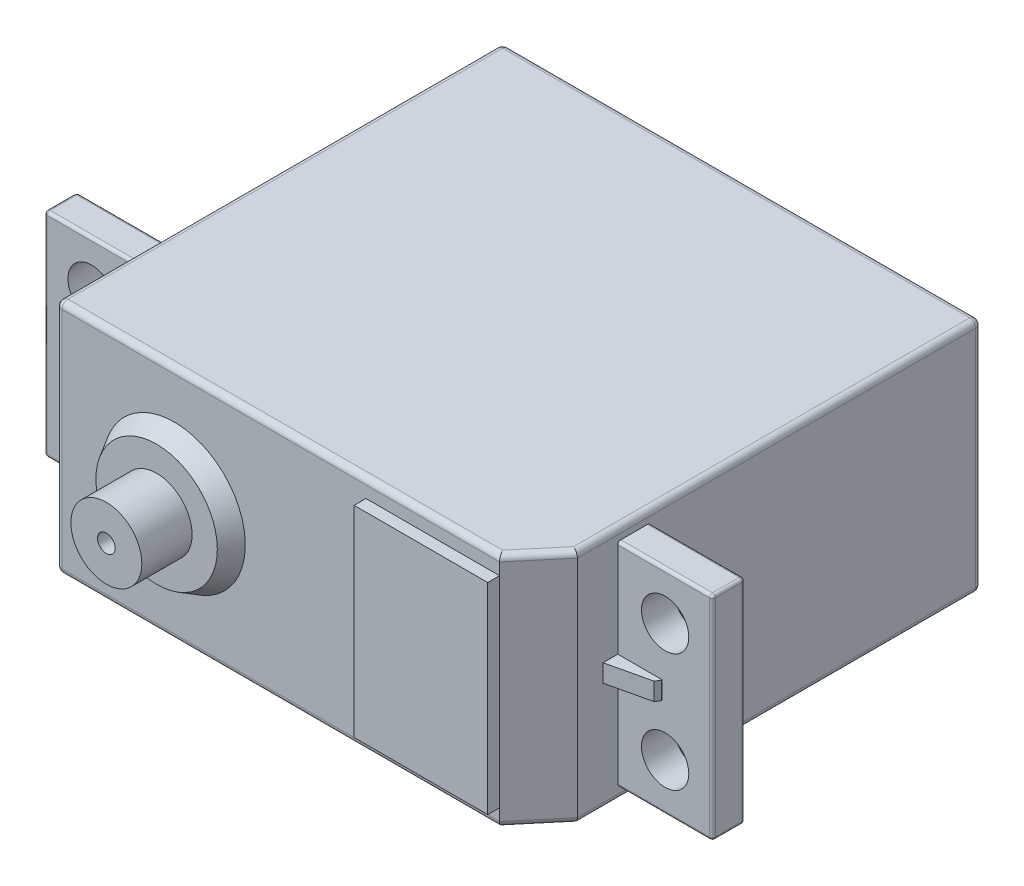
from build123d import *
from OCP.BRepFilletAPI import BRepFilletAPI_MakeChamfer

# Parameters (mm, degrees)
SKETCH1_W                 = 40.5
SKETCH1_H                 = 20
BOSS_EXTRUDE1_DEPTH       = 37.75
SKETCH2_W                 = 2.75
SKETCH2_H                 = 18
BOSS_EXTRUDE2_DEPTH       = 8
SKETCH3_R                 = 2
CUT_EXTRUDE1_DEPTH        = 4
SKETCH4_W                 = 3.75
SKETCH4_H                 = 1.5
BOSS_EXTRUDE3_DEPTH       = 1.25
CHAMFER1_SIZE2            = 0.865755717
CHAMFER1_SIZE             = 3.75
CHAMFER2_SIZE             = 0.25
CHAMFER2_SIZE2            = 0.333581356
FILLET1_R                 = 0.25
CHAMFER1_OF_MIRROR1_SIZE2 = 0.865755717
CHAMFER1_OF_MIRROR1_SIZE  = 3.75
CHAMFER2_OF_MIRROR1_SIZE2 = 0.25
CHAMFER2_OF_MIRROR1_SIZE  = 0.333581356
FILLET1_OF_MIRROR1_R      = 0.25
SKETCH5_W                 = 11.3
SKETCH5_H                 = 17
BOSS_EXTRUDE4_DEPTH       = 1
SKETCH6_R                 = 6
BOSS_EXTRUDE5_DEPTH       = 1.5
CHAMFER3_SIZE2            = 0.866025404
CHAMFER3_SIZE             = 1.5
SKETCH7_R                 = 3
SKETCH7_R_2               = 0.75
BOSS_EXTRUDE6_DEPTH       = 4.25
SKETCH8_W                 = 3.25
SKETCH8_H                 = 7.25
SKETCH8_W_2               = 1.25
SKETCH8_H_2               = 5.25
BOSS_EXTRUDE7_DEPTH       = 2.5
CHAMFER5_SIZE2            = 3.575260778
CHAMFER5_SIZE             = 3
CHAMFER4_SIZE             = 2.5
CHAMFER4_SIZE_2           = 0.669872981
FILLET2_R                 = 0.5


with BuildPart() as part:
    # Sketch1 → Boss-Extrude1 (new body)
    with BuildSketch(Plane.XY):
        Rectangle(SKETCH1_W, SKETCH1_H)
    extrude(amount=BOSS_EXTRUDE1_DEPTH)

    # Sketch2 → Boss-Extrude2 (add)
    with BuildSketch(Plane(origin=(20.25, 0, 0), x_dir=(0, 0, -1), z_dir=(1, 0, 0))):
        with Locations((-29.375, 0)):
            Rectangle(SKETCH2_W, SKETCH2_H)
    boss_extrude2 = extrude(amount=BOSS_EXTRUDE2_DEPTH)

    # Sketch3 → Cut-Extrude1 (cut)
    with BuildSketch(Plane.XY.offset(30.75)):
        with Locations((24.25, 5)):
            Circle(SKETCH3_R)
        with Locations((24.25, -5)):
            Circle(SKETCH3_R)
    cut_extrude1 = extrude(amount=-CUT_EXTRUDE1_DEPTH, mode=Mode.SUBTRACT)

    # Sketch4 → Boss-Extrude3 (add)
    with BuildSketch(Plane.XY.offset(30.75)):
        with Locations((22.125, 0)):
            Rectangle(SKETCH4_W, SKETCH4_H)
    boss_extrude3 = extrude(amount=BOSS_EXTRUDE3_DEPTH)

    # Chamfer1
    chamfer1_edges = [part.edges().sort_by_distance(p)[0] for p in [
        (24, 0, 32),
    ]]
    chamfer1_side = [part.faces().sort_by_distance(p)[0] for p in [
        (23.982684886, 0, 32),
    ]]
    chamfer(chamfer1_edges, length=CHAMFER1_SIZE - 0.0001, length2=CHAMFER1_SIZE2 - 0.0001, reference=chamfer1_side[0])  # a hair under: the kernel refuses the full size

    # Chamfer2
    chamfer2_edges = [part.edges().sort_by_distance(p)[0] for p in [
        (24, 0, 31.134344283),
    ]]
    chamfer2_side = [part.faces().sort_by_distance(p)[0] for p in [
        (22.12505, 0, 31.567172141),
    ]]
    chamfer(chamfer2_edges, length=CHAMFER2_SIZE, length2=CHAMFER2_SIZE2, reference=chamfer2_side[0])

    # Fillet1
    fillet1_edges = [part.edges().sort_by_distance(p)[0] for p in [
        (24.25, 9, 30.75),
        (24.25, -9, 30.75),
        (24.25, -9, 28),
        (24.25, 9, 28),
        (28.25, 0, 30.75),
        (28.25, -9, 29.375),
        (28.25, 0, 28),
        (28.25, 9, 29.375),
    ]]
    fillet(fillet1_edges, radius=FILLET1_R)

    # Mirror1: Boss-Extrude2, Cut-Extrude1, Boss-Extrude3 across plane
    add(boss_extrude2.mirror(Plane(origin=(0, 0, 0), x_dir=(0, 0, 1), z_dir=(1, 0, 0))))
    add(cut_extrude1.mirror(Plane(origin=(0, 0, 0), x_dir=(0, 0, 1), z_dir=(1, 0, 0))), mode=Mode.SUBTRACT)
    add(boss_extrude3.mirror(Plane(origin=(0, 0, 0), x_dir=(0, 0, 1), z_dir=(1, 0, 0))))

    # Chamfer1 of Mirror1
    chamfer1_of_mirror1_edges = [part.edges().sort_by_distance(p)[0] for p in [
        (-24, 0, 32),
    ]]
    chamfer1_of_mirror1_side = [part.faces().sort_by_distance(p)[0] for p in [
        (-23.982684886, 0, 32),
    ]]
    chamfer(chamfer1_of_mirror1_edges, length=CHAMFER1_OF_MIRROR1_SIZE - 0.0001, length2=CHAMFER1_OF_MIRROR1_SIZE2 - 0.0001, reference=chamfer1_of_mirror1_side[0])  # a hair under: the kernel refuses the full size

    # Chamfer2 of Mirror1
    chamfer2_of_mirror1_edges = [part.edges().sort_by_distance(p)[0] for p in [
        (-24, 0, 31.134344283),
    ]]
    chamfer(chamfer2_of_mirror1_edges, length=CHAMFER2_OF_MIRROR1_SIZE, length2=CHAMFER2_OF_MIRROR1_SIZE2)

    # Fillet1 of Mirror1
    fillet1_of_mirror1_edges = [part.edges().sort_by_distance(p)[0] for p in [
        (-24.25, 9, 30.75),
        (-24.25, -9, 30.75),
        (-24.25, -9, 28),
        (-24.25, 9, 28),
        (-28.25, 0, 30.75),
        (-28.25, -9, 29.375),
        (-28.25, 0, 28),
        (-28.25, 9, 29.375),
    ]]
    fillet(fillet1_of_mirror1_edges, radius=FILLET1_OF_MIRROR1_R)

    # Sketch5 → Boss-Extrude4 (add)
    with BuildSketch(Plane.XY.offset(37.75)):
        with Locations((11.6, 0)):
            Rectangle(SKETCH5_W, SKETCH5_H)
    extrude(amount=BOSS_EXTRUDE4_DEPTH)

    # Sketch6 → Boss-Extrude5 (add)
    with BuildSketch(Plane.XY.offset(37.75)):
        with Locations(Location((-10.25, 0, 0), (0, 0, 180))):
            Circle(SKETCH6_R)
    extrude(amount=BOSS_EXTRUDE5_DEPTH)

    # Chamfer3
    chamfer3_edges = [part.edges().sort_by_distance(p)[0] for p in [
        (-4.25, 0, 39.25),
    ]]
    chamfer3_side = [part.faces().sort_by_distance(p)[0] for p in [
        (-4.25, 0, 39.232679492),
    ]]
    chamfer(chamfer3_edges, length=CHAMFER3_SIZE - 0.0001, length2=CHAMFER3_SIZE2 - 0.0001, reference=chamfer3_side[0])  # a hair under: the kernel refuses the full size

    # Sketch7 → Boss-Extrude6 (add)
    with BuildSketch(Plane.XY.offset(39.25)):
        with Locations((-10.25, 0)):
            Circle(SKETCH7_R)
        with Locations((-10.25, 0)):
            Circle(SKETCH7_R_2, mode=Mode.SUBTRACT)
    extrude(amount=BOSS_EXTRUDE6_DEPTH)

    # Sketch8 → Boss-Extrude7 (add)
    with BuildSketch(Plane.ZY.offset(20.25)):
        with Locations((3.125, 0)):
            Rectangle(SKETCH8_W, SKETCH8_H)
        with Locations((3.125, 0)):
            Rectangle(SKETCH8_W_2, SKETCH8_H_2, mode=Mode.SUBTRACT)
    extrude(amount=BOSS_EXTRUDE7_DEPTH)

    # Chamfer5
    chamfer5_edges = [part.edges().sort_by_distance(p)[0] for p in [
        (20.25, 0, 37.75),
    ]]
    chamfer5_side = [part.faces().sort_by_distance(p)[0] for p in [
        (20.19, 0, 37.75),
    ]]
    chamfer(chamfer5_edges, length=CHAMFER5_SIZE - 0.0001, length2=CHAMFER5_SIZE2 - 0.0001, reference=chamfer5_side[0])  # a hair under: the kernel refuses the full size

    # Chamfer4
    chamfer4_edges_1 = [part.edges().sort_by_distance(p)[0] for p in [
        (-22.75, -3.625, 3.125),
    ]]
    chamfer4_side_1 = [part.faces().sort_by_distance(p)[0] for p in [
        (-22.73660254, -3.625, 3.125),
    ]]
    chamfer4_edges_2 = [part.edges().sort_by_distance(p)[0] for p in [
        (-22.75, 0, 4.75),
    ]]
    chamfer4_side_2 = [part.faces().sort_by_distance(p)[0] for p in [
        (-22.73660254, 0, 4.75),
    ]]
    chamfer4_edges_3 = [part.edges().sort_by_distance(p)[0] for p in [
        (-22.75, 3.625, 3.125),
    ]]
    chamfer4_side_3 = [part.faces().sort_by_distance(p)[0] for p in [
        (-22.73660254, 3.625, 3.125),
    ]]
    chamfer4_edges_4 = [part.edges().sort_by_distance(p)[0] for p in [
        (-22.75, 0, 1.5),
    ]]
    chamfer4_side_4 = [part.faces().sort_by_distance(p)[0] for p in [
        (-22.73660254, 0, 1.5),
    ]]
    chamfer4 = BRepFilletAPI_MakeChamfer(part.part.solid().wrapped)
    for e in chamfer4_edges_1:
        chamfer4.Add(CHAMFER4_SIZE - 0.0001, CHAMFER4_SIZE_2 - 0.0001, e.wrapped, chamfer4_side_1[0].wrapped)
    for e in chamfer4_edges_2:
        chamfer4.Add(CHAMFER4_SIZE - 0.0001, CHAMFER4_SIZE_2 - 0.0001, e.wrapped, chamfer4_side_2[0].wrapped)
    for e in chamfer4_edges_3:
        chamfer4.Add(CHAMFER4_SIZE - 0.0001, CHAMFER4_SIZE_2 - 0.0001, e.wrapped, chamfer4_side_3[0].wrapped)
    for e in chamfer4_edges_4:
        chamfer4.Add(CHAMFER4_SIZE - 0.0001, CHAMFER4_SIZE_2 - 0.0001, e.wrapped, chamfer4_side_4[0].wrapped)
    add(Compound.cast(chamfer4.Shape()), mode=Mode.REPLACE)  # a hair under: the kernel refuses the full size

    # Fillet2
    fillet2_edges = [part.edges().sort_by_distance(p)[0] for p in [
        (-20.25, 0, 37.75),
        (-1.49995, -10, 37.75),
        (-1.49995, 10, 37.75),
        (20.25, 10, 17.087419611),
        (18.75005, 10, 35.962419611),
        (20.25, -10, 17.087419611),
        (18.75005, -10, 35.962419611),
        (0, -10, 0),
        (-20.25, 0, 0),
        (0, 10, 0),
        (20.25, 0, 0),
        (-20.25, -10, 18.875),
        (-20.25, 10, 18.875),
    ]]
    fillet(fillet2_edges, radius=FILLET2_R)


solid = part.part
